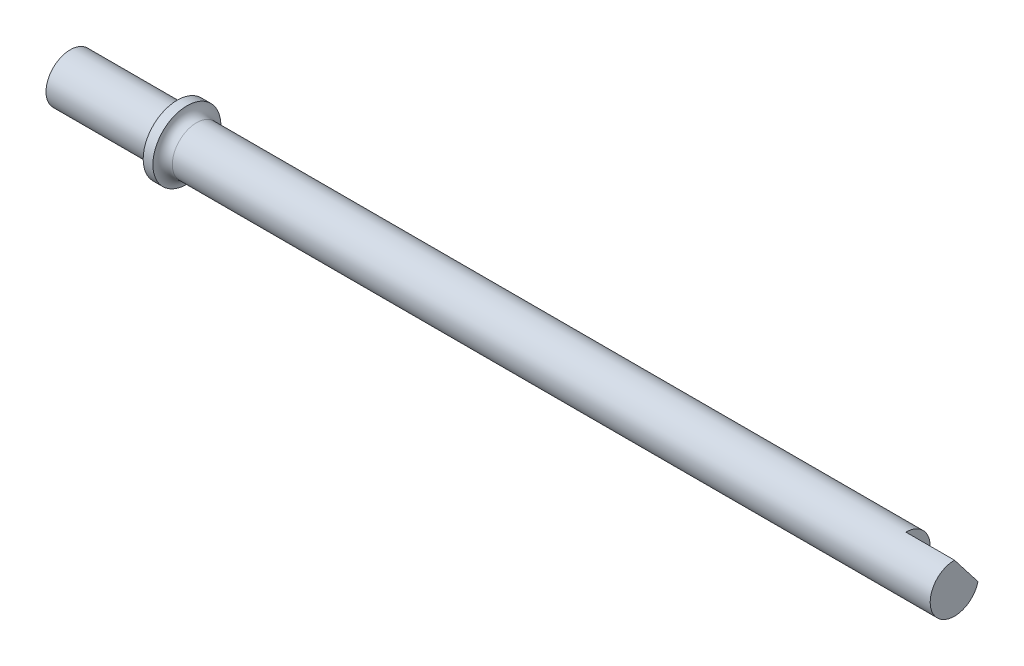
from build123d import *

# Parameters (mm, degrees)
ESQUISSE1_W                  = 36
ESQUISSE1_H                  = 5
ESQUISSE1_W_2                = 2
ESQUISSE1_H_2                = 2
CONG_1_R                     = 2
ESQUISSE6_R                  = 2
ENL_V_MAT_EXTRU_2_DEPTH      = 5
ESQUISSE7_R                  = 3
ENL_V_MAT_EXTRU_3_DEPTH      = 16.3
ENL_V_MAT_EXTRU_4_DEPTH      = 183.269032028
ENL_V_MAT_EXTRU_4_DEPTH_BACK = 10


with BuildPart() as part:
    # Esquisse1 → Révolution1 (revolve)
    with BuildSketch(Plane.XY, mode=Mode.PRIVATE) as r_volution1_sk:
        Polygon((0, 5), (0, 0), (146, 0), (146, 5), (24, 5), (22, 5), align=None)
        with Locations((164, 2.5)):
            Rectangle(ESQUISSE1_W, ESQUISSE1_H)
        with Locations((23, 6)):
            Rectangle(ESQUISSE1_W_2, ESQUISSE1_H_2)
    revolve(r_volution1_sk.sketch.rotate(Axis((-22.396751432, 0, 0), (1, 0, 0)), 90), axis=Axis((-22.396751432, 0, 0), (1, 0, 0)))

    # Congé1
    cong_1_edges = [part.edges().sort_by_distance(p)[0] for p in [
        (24, 0, -5),
    ]]
    fillet(cong_1_edges, radius=CONG_1_R - 0.0001)  # a hair under: the kernel refuses the full size

    # Esquisse6 → Enlèv. mat.-Extru.2 (cut)
    with BuildSketch(Plane(origin=(0, -5, 0), x_dir=(-1, 0, 0), z_dir=(0, -1, 0))):
        with Locations(Location((-7.5, 0, 0), (0, 0, 180))):
            Circle(ESQUISSE6_R)
    extrude(amount=-ENL_V_MAT_EXTRU_2_DEPTH, mode=Mode.SUBTRACT)

    # Esquisse7 → Enlèv. mat.-Extru.3 (cut)
    with BuildSketch(Plane.ZY):
        Circle(ESQUISSE7_R)
    extrude(amount=-ENL_V_MAT_EXTRU_3_DEPTH, mode=Mode.SUBTRACT)

    # Esquisse8 → Enlèv. mat.-Extru.4 (cut, two sides: drawn at the far end of the back side and taken through both)
    with BuildSketch(Plane(origin=(182, 0, 0), x_dir=(0, 0, -1), z_dir=(1, 0, 0)).offset(-ENL_V_MAT_EXTRU_4_DEPTH_BACK)):
        Polygon((-23.820180397, 35.700913916), (0, 5), (4.843224662, -1.2422459), (28.663405059, -31.943159816), (90.065232892, 15.697200979), (37.581647435, 83.341274711), align=None)
    extrude(amount=ENL_V_MAT_EXTRU_4_DEPTH + ENL_V_MAT_EXTRU_4_DEPTH_BACK, mode=Mode.SUBTRACT)


solid = part.part
